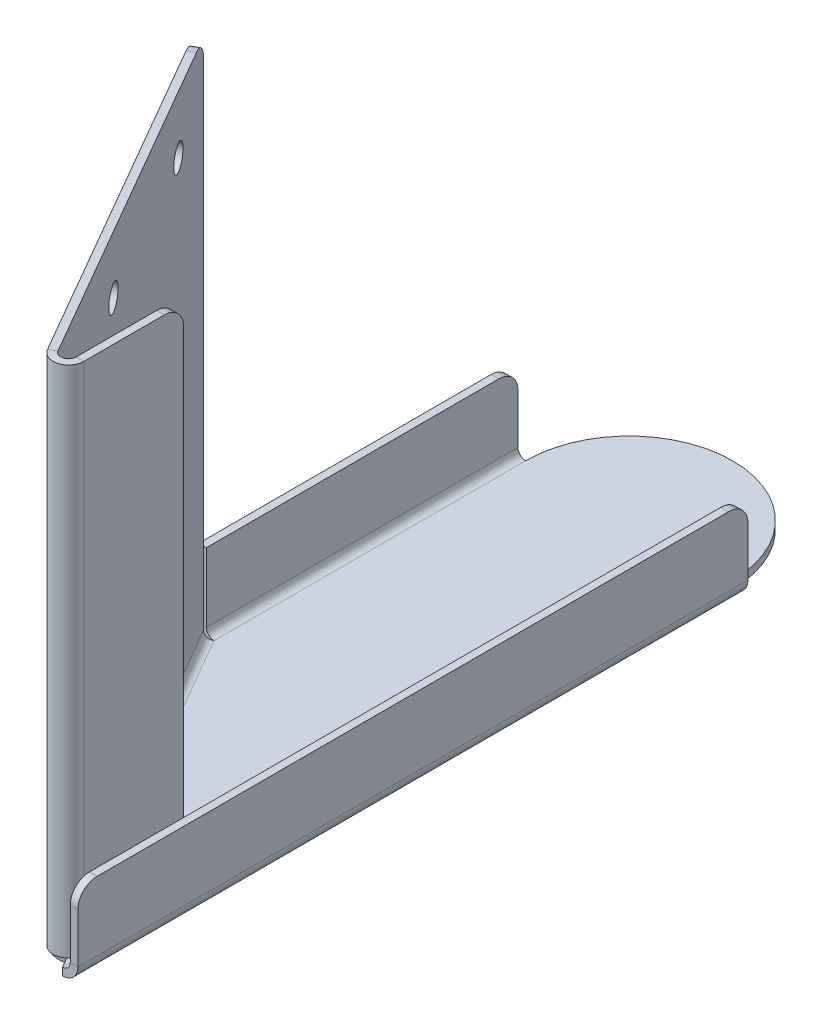
from build123d import *

# Parameters (mm, degrees)
BOSS_EXTRUDE1_DEPTH     = 2
BOSS_EXTRUDE3_DEPTH     = 2
EDGE_FLANGE1_DEPTH      = 81.3
EDGE_FLANGE1_BEND_DEPTH = 174.830743609
EDGE_FLANGE2_DEPTH      = 103.8
EDGE_FLANGE3_DEPTH      = 134
M6_CLEARANCE_HOLE1_D    = 6.6
FILLET1_R               = 5


# Sheet-metal steps are written as plain solids
with BuildPart() as part:
    # Sketch1 → Boss-Extrude1 (new body)
    with BuildSketch(Plane(origin=(0, 0, 0), x_dir=(1, 0, 0), z_dir=(0, 1, 0))):
        with BuildLine():
            Line((-27, -108.3), (-27, -27))
            ThreePointArc((-27, -27), (-19.091883092, -7.908116908), (0, 0))
            Line((0, 0), (0, -108.3))
            Line((0, -108.3), (-27, -108.3))
        make_face()
    boss_extrude1 = extrude(amount=BOSS_EXTRUDE1_DEPTH)

    # Mirror1: Boss-Extrude1 across plane
    add(boss_extrude1.mirror(Plane(origin=(0, 0, 0), x_dir=(0, 0, 1), z_dir=(1, 0, 0))))

    # Sketch15 → Boss-Extrude3 (add)
    with BuildSketch(Plane(origin=(0, 2, 0), x_dir=(1, 0, 0), z_dir=(0, 1, 0))):
        Polygon((-27, -108.3), (27, -201.830743609), (27, -108.3), align=None)
    extrude(amount=-BOSS_EXTRUDE3_DEPTH)

    # Edge-Flange1 section (across the edge) → Edge-Flange1 (add)
    with BuildSketch(Plane(origin=(-29, 2, 27), x_dir=(1, 0, 0), z_dir=(0, 0, 1))):
        with BuildLine():
            Line((-2, 2), (-2, 20))
            Line((-2, 20), (0, 20))
            Line((0, 20), (0, 2))
            ThreePointArc((0, 2), (0.585786438, 0.585786438), (2, 0))
            Line((2, 0), (2, -2))
            ThreePointArc((2, -2), (-0.828427125, -0.828427125), (-2, 2))
        make_face()
    extrude(amount=EDGE_FLANGE1_DEPTH)

    # Edge-Flange1 section 2 (across the edge) → Edge-Flange1 bend (add)
    with BuildSketch(Plane(origin=(29, 2, 201.830743609), x_dir=(-1, 0, 0), z_dir=(0, 0, -1))):
        with BuildLine():
            Line((-2, 2), (-2, 20))
            Line((-2, 20), (0, 20))
            Line((0, 20), (0, 2))
            ThreePointArc((0, 2), (0.585786438, 0.585786438), (2, 0))
            Line((2, 0), (2, -2))
            ThreePointArc((2, -2), (-0.828427125, -0.828427125), (-2, 2))
        make_face()
    extrude(amount=EDGE_FLANGE1_BEND_DEPTH)

    # Edge-Flange2 section (across the edge) → Edge-Flange2 (add)
    with BuildSketch(Plane(origin=(-28.732050808, 2, 109.3), x_dir=(0.8660254037844362, 3.491481338843134e-15, -0.5000000000000044), z_dir=(0.5000000000000044, 0, 0.8660254037844362))):
        with BuildLine():
            Line((-2, 2), (-2, 136))
            Line((-2, 136), (0, 136))
            Line((0, 136), (0, 2))
            ThreePointArc((0, 2), (0.585786438, 0.585786438), (2, 0))
            Line((2, 0), (2, -2))
            ThreePointArc((2, -2), (-0.828427125, -0.828427125), (-2, 2))
        make_face()
    extrude(amount=EDGE_FLANGE2_DEPTH)

    # Edge-Flange3 section (across the edge) → Edge-Flange3 (add)
    with BuildSketch(Plane(origin=(26.9, 138, 205.657538528), x_dir=(-1, 0, 0), z_dir=(0, -1, 0))):
        with BuildLine():
            Line((-2, 7.464101615), (-2, 33.464101615))
            Line((-2, 33.464101615), (0, 33.464101615))
            Line((0, 33.464101615), (0, 7.464101615))
            ThreePointArc((0, 7.464101615), (1.48236191, 5.532249963), (3.732050808, 6.464101615))
            Line((3.732050808, 6.464101615), (5.464101615, 5.464101615))
            ThreePointArc((5.464101615, 5.464101615), (0.96472382, 3.60039831), (-2, 7.464101615))
        make_face()
    extrude(amount=EDGE_FLANGE3_DEPTH)

    # M6 Clearance Hole1 (through all)
    with Locations(Plane(origin=(-68.877326422, 0, 39.766342951), x_dir=(-0.5000000000000046, -2.00195274507357e-15, -0.8660254037844362), z_dir=(0.8660254037844362, 3.4674838688193673e-15, -0.5000000000000046))):
        with Locations((-144.573890731, 123), (-98.29055123, 123)):
            Hole(M6_CLEARANCE_HOLE1_D / 2)

    # Fillet1
    fillet1_edges = [part.edges().sort_by_distance(p)[0] for p in [
        (-30, 22, 27),
        (30, 22, 201.830743609),
        (30, 22, 27),
        (-29.598076211, 138, 109.8),
        (27.9, 138, 172.193436913),
    ]]
    fillet(fillet1_edges, radius=FILLET1_R)


solid = part.part
